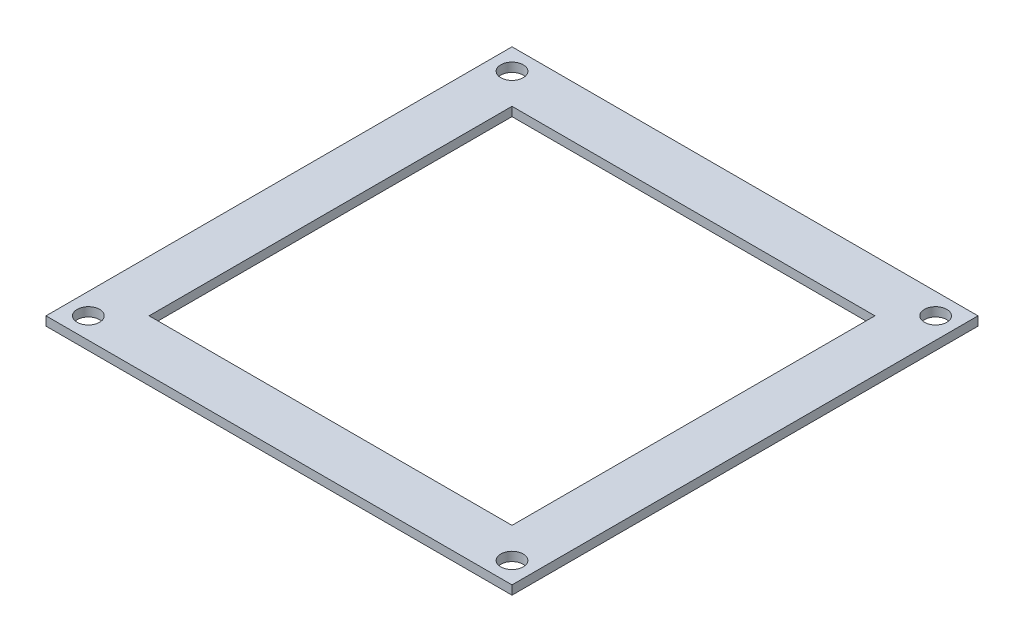
from build123d import *

# Parameters (mm, degrees)
SKETCH1_W           = 66
SKETCH1_H           = 66
SKETCH1_R           = 1.59
SKETCH1_W_2         = 51.4
SKETCH1_H_2         = 51.4
BOSS_EXTRUDE1_DEPTH = 1.27


with BuildPart() as part:
    # Sketch1 → Boss-Extrude1 (new body)
    with BuildSketch(Plane(origin=(0, 0, 0), x_dir=(1, 0, 0), z_dir=(0, 1, 0))):
        Rectangle(SKETCH1_W, SKETCH1_H)
        with Locations((-30, 30)):
            Circle(SKETCH1_R, mode=Mode.SUBTRACT)
        with Locations((30, 30)):
            Circle(SKETCH1_R, mode=Mode.SUBTRACT)
        with Locations((30, -30)):
            Circle(SKETCH1_R, mode=Mode.SUBTRACT)
        with Locations((-30, -30)):
            Circle(SKETCH1_R, mode=Mode.SUBTRACT)
        Rectangle(SKETCH1_W_2, SKETCH1_H_2, mode=Mode.SUBTRACT)
    extrude(amount=BOSS_EXTRUDE1_DEPTH)


solid = part.part
